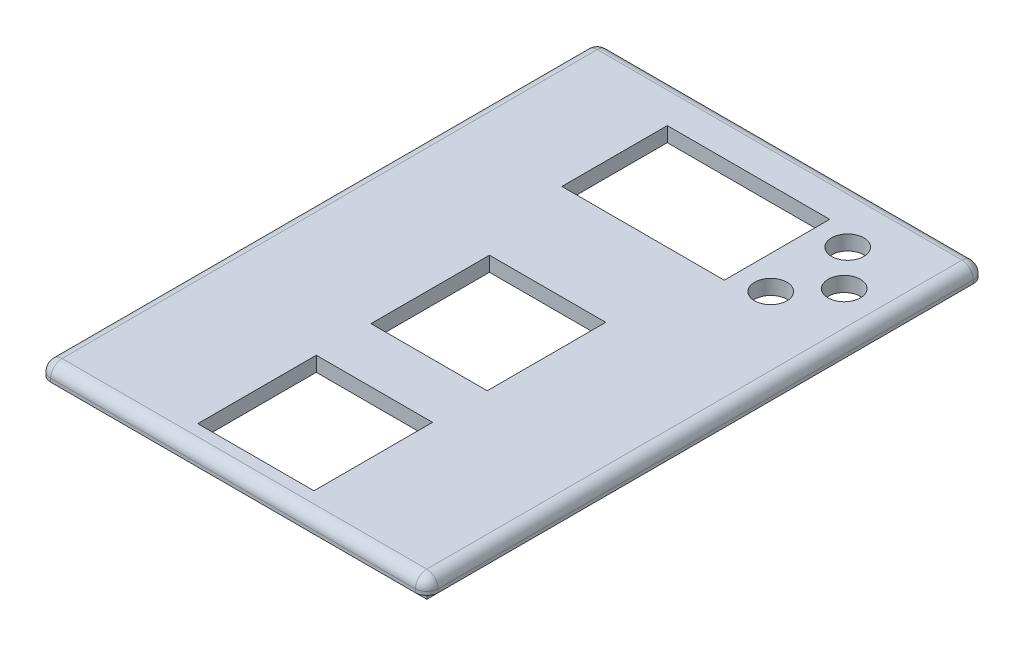
from build123d import *

# Parameters (mm, degrees)
SKETCH1_W           = 86.36
SKETCH1_H           = 124.333
BOSS_EXTRUDE1_DEPTH = 3.302
SKETCH2_W           = 81.28
SKETCH2_H           = 119.253
BOSS_EXTRUDE2_DEPTH = 2.54
CUT_EXTRUDE1_DEPTH  = 2.54
SKETCH6_W           = 25.908
SKETCH6_H           = 26.416
SKETCH6_W_2         = 36.195
SKETCH6_H_2         = 23.495
CUT_EXTRUDE2_DEPTH  = 3.302
FILLET1_R           = 2.54
SKETCH7_R           = 3.6
CUT_EXTRUDE3_DEPTH  = 152.495456872


with BuildPart() as part:
    # Sketch1 → Boss-Extrude1 (new body)
    with BuildSketch(Plane(origin=(0, 0, 0), x_dir=(1, 0, 0), z_dir=(0, 1, 0))):
        with Locations((43.18, 62.1665)):
            Rectangle(SKETCH1_W, SKETCH1_H)
    extrude(amount=BOSS_EXTRUDE1_DEPTH)

    # Sketch2 → Boss-Extrude2 (add)
    with BuildSketch(Plane.XZ):
        with Locations((43.18, -62.1665)):
            Rectangle(SKETCH2_W, SKETCH2_H)
    extrude(amount=BOSS_EXTRUDE2_DEPTH)

    # Sketch4 → Cut-Extrude1 (cut)
    with BuildSketch(Plane.XZ.offset(2.54)):
        Polygon((63.5, -121.793), (63.5, -119.253), (81.28, -119.253), (81.28, -5.08), (63.5, -5.08), (63.5, -2.54), (22.86, -2.54), (22.86, -5.08), (5.08, -5.08), (5.08, -119.253), (22.86, -119.253), (22.86, -121.793), align=None)
    extrude(amount=-CUT_EXTRUDE1_DEPTH, mode=Mode.SUBTRACT)

    # Sketch6 → Cut-Extrude2 (cut)
    with BuildSketch(Plane(origin=(0, 3.302, 0), x_dir=(1, 0, 0), z_dir=(0, 1, 0))):
        with Locations((43.18, 18.288)):
            Rectangle(SKETCH6_W, SKETCH6_H)
        with Locations((43.18, 56.896)):
            Rectangle(SKETCH6_W, SKETCH6_H)
        with Locations((43.1165, 103.1875)):
            Rectangle(SKETCH6_W_2, SKETCH6_H_2)
    extrude(amount=-CUT_EXTRUDE2_DEPTH, mode=Mode.SUBTRACT)

    # Fillet1
    fillet1_edges = [part.edges().sort_by_distance(p)[0] for p in [
        (86.36, 3.302, -62.1665),
        (43.18, 3.302, 0),
        (43.18, 3.302, -124.333),
        (0, 3.302, -62.1665),
        (0, 1.651, -124.333),
        (0, 1.651, 0),
        (86.36, 1.651, 0),
        (86.36, 1.651, -124.333),
    ]]
    fillet(fillet1_edges, radius=FILLET1_R)

    # Sketch7 → Cut-Extrude3 (cut, through all)
    with BuildSketch(Plane(origin=(0, 3.302, 0), x_dir=(1, 0, 0), z_dir=(0, 1, 0))):
        with Locations((68.58, 111.578879738)):
            Circle(SKETCH7_R)
        with Locations((76.2, 103.1875)):
            Circle(SKETCH7_R)
        with Locations((68.58, 94.433879738)):
            Circle(SKETCH7_R)
    extrude(amount=-CUT_EXTRUDE3_DEPTH, mode=Mode.SUBTRACT)


solid = part.part
